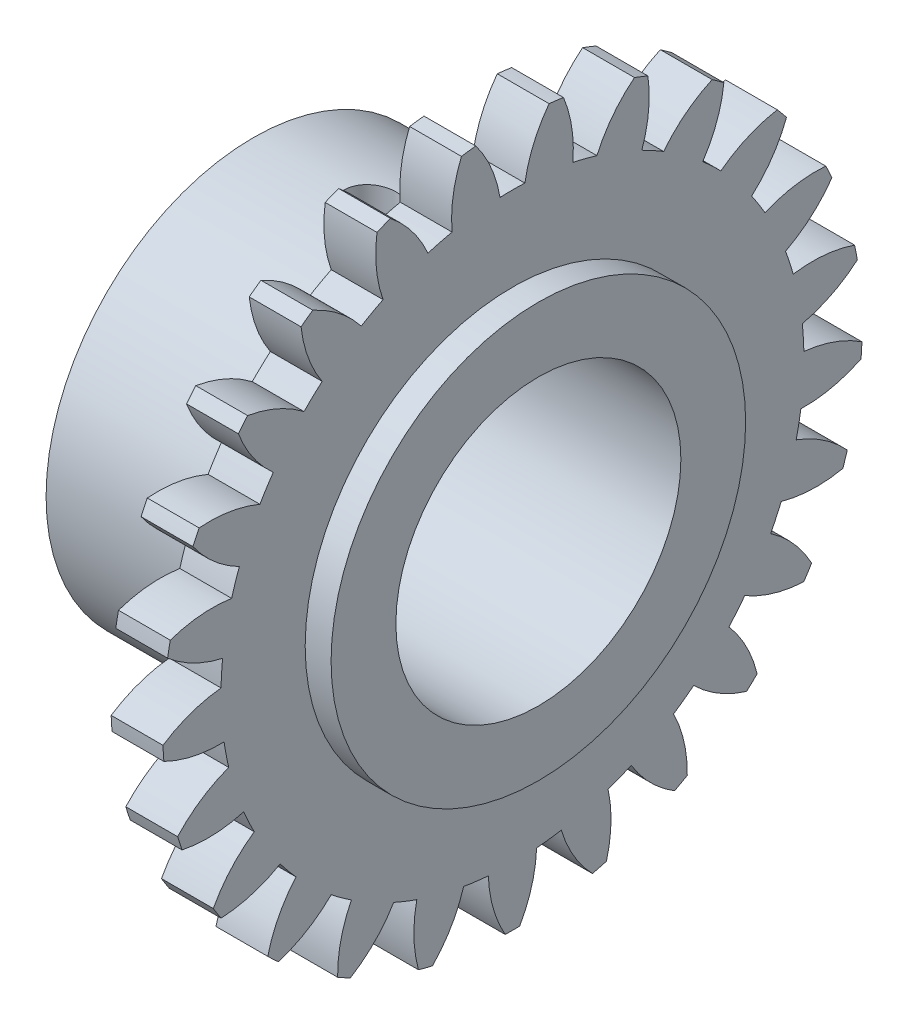
from build123d import *
from build123d.topology import SkipClean

# Parameters (mm, degrees)
BASPROSKE_W        = 2
BASPROSKE_H        = 13.5
TOOTHCUT_DEPTH     = 20.19635382
TEETHCUTS_COUNT    = 25
TEETHCUTS_ANGLE    = 345.6
BORSKE_R           = 5.5
BORE_DEPTH         = 50.0000508
BOSS_EXTRU_1_START = 1
ESQUISSE1_R        = 8
ESQUISSE1_R_2      = 5.5
BOSS_EXTRU_1_DEPTH = 1
ESQUISSE2_R        = 8
ESQUISSE2_R_2      = 5.5
BOSS_EXTRU_2_DEPTH = 8
ESQUISSE4_W        = 1
ESQUISSE4_H        = 13.425711508


with BuildPart() as part:
    # BasProSke → Base-Revolve (revolve)
    with BuildSketch(Plane(origin=(0, 0, 0), x_dir=(1, 0, 0), z_dir=(0, 1, 0))):
        with Locations((1, 6.75)):
            Rectangle(BASPROSKE_W, BASPROSKE_H)
    revolve(axis=Axis((-10, 0, 0), (1, 0, 0)))

    # TooCutSke → ToothCut (cut, through all)
    with BuildSketch(Plane(origin=(0, 0, 0), x_dir=(0, 0, -1), z_dir=(1, 0, 0))):
        with BuildLine():
            ThreePointArc((0.480087995, 11.238750665), (0, 11.249), (-0.480087995, 11.238750665))
            ThreePointArc((-0.480087995, 11.238750665), (-0.821124963, 12.40220054), (-1.432168974, 13.449361962))
            ThreePointArc((-1.432168974, 13.449361962), (0, 13.5254), (1.432168974, 13.449361962))
            ThreePointArc((1.432168974, 13.449361962), (0.821124963, 12.40220054), (0.480087995, 11.238750665))
        make_face()
    toothcut = extrude(amount=TOOTHCUT_DEPTH, mode=Mode.SUBTRACT)

    # TeethCuts: ToothCut ×25 about axis
    teethcuts_axis = Axis((-10, 0, 0), (1, 0, 0))
    for i in range(1, TEETHCUTS_COUNT):
        add(toothcut.rotate(teethcuts_axis, i * TEETHCUTS_ANGLE / (TEETHCUTS_COUNT - 1)), mode=Mode.SUBTRACT)

    # BorSke → Bore (cut, symmetric)
    with BuildSketch(Plane(origin=(0, 0, 0), x_dir=(0, 0, -1), z_dir=(1, 0, 0))):
        Circle(BORSKE_R)
    extrude(amount=BORE_DEPTH, both=True, mode=Mode.SUBTRACT)

    # Esquisse1 → Boss.-Extru.1 (add)
    with BuildSketch(Plane(origin=(2, 0, 0), x_dir=(0, 0, -1), z_dir=(1, 0, 0)).offset(BOSS_EXTRU_1_START)):
        Circle(ESQUISSE1_R)
        Circle(ESQUISSE1_R_2, mode=Mode.SUBTRACT)
    extrude(amount=-BOSS_EXTRU_1_DEPTH)

    # Esquisse2 → Boss.-Extru.2 (add)
    with SkipClean():  # the faces are left unmerged after this step: merging them gives an invalid solid
        with BuildSketch(Plane.ZY):
            Circle(ESQUISSE2_R)
            Circle(ESQUISSE2_R_2, mode=Mode.SUBTRACT)
        extrude(amount=BOSS_EXTRU_2_DEPTH)

    # Esquisse4 → Diamètre du perçage Ø2.0 (2)1 (revolve, cut)
    with SkipClean():  # the faces are left unmerged after this step: merging them gives an invalid solid
        with BuildSketch(Plane(origin=(-3.5, 0, 0), x_dir=(0, 0, -1), z_dir=(1, 0, 0))):
            with Locations((0.5, 6.712855754)):
                Rectangle(ESQUISSE4_W, ESQUISSE4_H)
        revolve(axis=Axis((-3.5, -6.35, 0), (0, 1, 0)), mode=Mode.SUBTRACT)


solid = part.part
